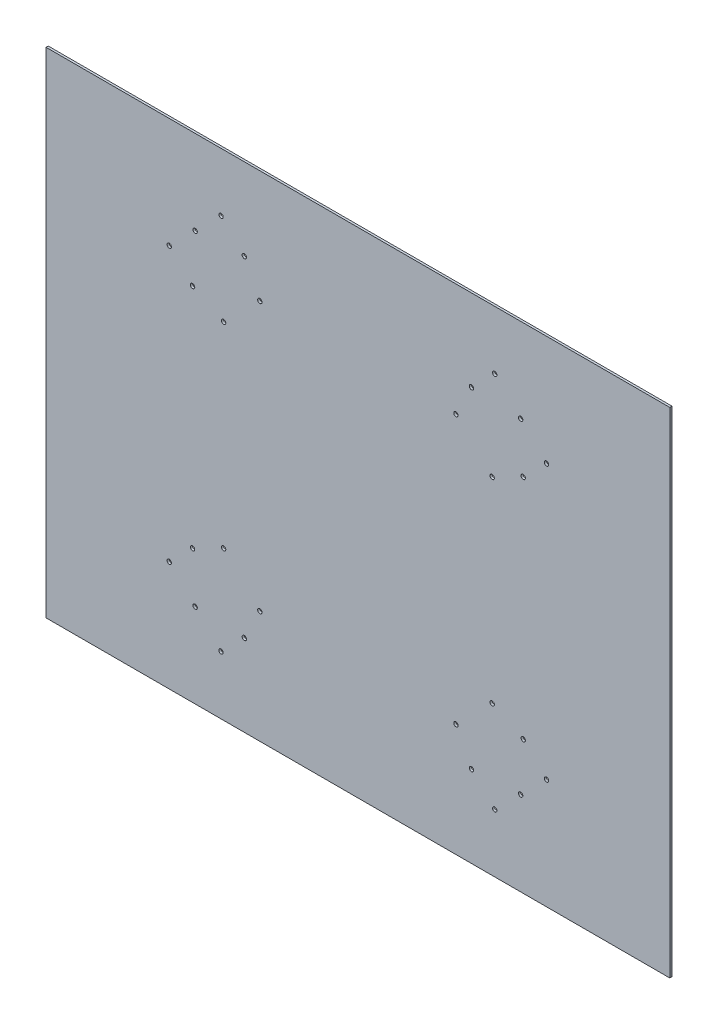
from build123d import *

# Parameters (mm, degrees)
SKETCH1_W           = 852
SKETCH1_H           = 675
SKETCH1_R           = 3
BOSS_EXTRUDE2_DEPTH = 3


with BuildPart() as part:
    # Sketch1 → Boss-Extrude2 (new body)
    with BuildSketch(Plane.XY):
        with Locations((1065.777273447, -1504.227226955)):
            Rectangle(SKETCH1_W, SKETCH1_H)
        with Locations((1288.091645453, -1281.91285495)):
            Circle(SKETCH1_R, mode=Mode.SUBTRACT)
        with Locations((843.462901442, -1726.54159896)):
            Circle(SKETCH1_R, mode=Mode.SUBTRACT)
        with Locations((931.851249091, -1687.650725995)):
            Circle(SKETCH1_R, mode=Mode.SUBTRACT)
        with Locations((910.638045655, -1730.077132866)):
            Circle(SKETCH1_R, mode=Mode.SUBTRACT)
        with Locations((878.818240502, -1761.896938019)):
            Circle(SKETCH1_R, mode=Mode.SUBTRACT)
        with Locations((1323.446984512, -1317.268194009)):
            Circle(SKETCH1_R, mode=Mode.SUBTRACT)
        with Locations((1249.200772487, -1370.301202598)):
            Circle(SKETCH1_R, mode=Mode.SUBTRACT)
        with Locations((1291.627179358, -1349.087999163)):
            Circle(SKETCH1_R, mode=Mode.SUBTRACT)
        with Locations((1220.91650124, -1278.377321044)):
            Circle(SKETCH1_R, mode=Mode.SUBTRACT)
        with Locations((1199.703297804, -1320.803727915)):
            Circle(SKETCH1_R, mode=Mode.SUBTRACT)
        with Locations((1252.736306393, -1246.55751589)):
            Circle(SKETCH1_R, mode=Mode.SUBTRACT)
        with Locations((882.353774408, -1638.153251312)):
            Circle(SKETCH1_R, mode=Mode.SUBTRACT)
        with Locations((808.107562383, -1691.186259901)):
            Circle(SKETCH1_R, mode=Mode.SUBTRACT)
        with Locations((839.927367536, -1659.366454747)):
            Circle(SKETCH1_R, mode=Mode.SUBTRACT)
        with Locations((1291.627179358, -1659.366454747)):
            Circle(SKETCH1_R, mode=Mode.SUBTRACT)
        with Locations((1323.446984512, -1691.186259901)):
            Circle(SKETCH1_R, mode=Mode.SUBTRACT)
        with Locations((1288.091645453, -1726.54159896)):
            Circle(SKETCH1_R, mode=Mode.SUBTRACT)
        with Locations((1252.736306393, -1761.896938019)):
            Circle(SKETCH1_R, mode=Mode.SUBTRACT)
        with Locations((1220.91650124, -1730.077132866)):
            Circle(SKETCH1_R, mode=Mode.SUBTRACT)
        with Locations((1199.703297804, -1687.650725995)):
            Circle(SKETCH1_R, mode=Mode.SUBTRACT)
        with Locations((1249.200772487, -1638.153251312)):
            Circle(SKETCH1_R, mode=Mode.SUBTRACT)
        with Locations((839.927367536, -1349.087999163)):
            Circle(SKETCH1_R, mode=Mode.SUBTRACT)
        with Locations((808.107562383, -1317.268194009)):
            Circle(SKETCH1_R, mode=Mode.SUBTRACT)
        with Locations((843.462901442, -1281.91285495)):
            Circle(SKETCH1_R, mode=Mode.SUBTRACT)
        with Locations((878.818240502, -1246.55751589)):
            Circle(SKETCH1_R, mode=Mode.SUBTRACT)
        with Locations((910.638045655, -1278.377321044)):
            Circle(SKETCH1_R, mode=Mode.SUBTRACT)
        with Locations((931.851249091, -1320.803727915)):
            Circle(SKETCH1_R, mode=Mode.SUBTRACT)
        with Locations((882.353774408, -1370.301202598)):
            Circle(SKETCH1_R, mode=Mode.SUBTRACT)
    extrude(amount=BOSS_EXTRUDE2_DEPTH)


solid = part.part
